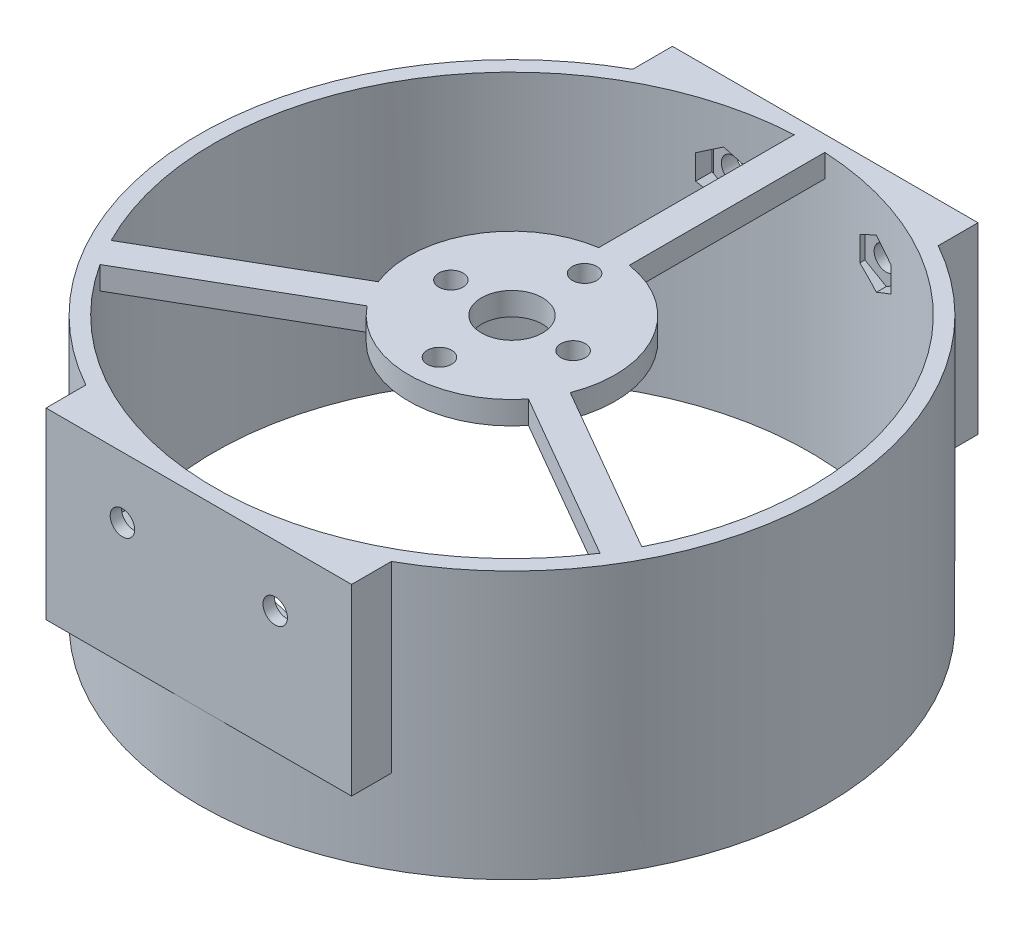
from build123d import *

# Parameters (mm, degrees)
SKETCH_1_R           = 41
SKETCH_1_R_2         = 39
EXTRUDE_1_DEPTH      = 20
EXTRUDE_START        = -14
EXTRUDE_2_DEPTH      = 14
EXTRUDE_START_2      = -3
SKETCH_3_R           = 4
SKETCH_3_R_2         = 1.6
EXTRUDE_3_DEPTH      = 3
CUT_EXTRUDE_3_DEPTH  = 3
EXTRUDE_5_DEPTH      = 10
EXTRUDE_5_DEPTH_BACK = 15
SKETCH_1_2_R         = 41
SKETCH_1_2_R_2       = 39
EXTRUDE_START_3      = 10
EXTRUDE_7_DEPTH      = 10
EXTRUDE_8_DEPTH      = 10
EXTRUDE_8_DEPTH_BACK = 5
CUT_EXTRUDE_4_DEPTH  = 80
EXTRUDE_START_4      = -24
EXTRUDE_10_DEPTH     = 24
EXTRUDE_9_DEPTH      = 10
EXTRUDE_9_DEPTH_BACK = 1.5
CUT_EXTRUDE_6_DEPTH  = 10
SKETCH_16_R          = 1.6
CUT_EXTRUDE_7_DEPTH  = 103
SKETCH_18_R          = 1.6
CUT_EXTRUDE_8_DEPTH  = 10
SKETCH_18_4_R        = 1.6
CUT_EXTRUDE_9_DEPTH  = 10


with BuildPart() as part:
    # 草图1 → 凸台-拉伸1 (new body)
    with BuildSketch(Plane(origin=(0, 0, 0), x_dir=(1, 0, 0), z_dir=(0, 1, 0))):
        Circle(SKETCH_1_R)
        Circle(SKETCH_1_R_2, mode=Mode.SUBTRACT)
    extrude(amount=EXTRUDE_1_DEPTH)

    # 草图2 → 凸台-拉伸2 (add)
    with BuildSketch(Plane(origin=(0, 20, 0), x_dir=(1, 0, 0), z_dir=(0, 1, 0)).offset(EXTRUDE_START)):
        with BuildLine():
            Line((3.5e-08, -41), (20, -41))
            Line((20, -41), (20, -35.791060336))
            ThreePointArc((20, -35.791060336), (10.333598766, -39.676400247), (3.5e-08, -41))
        make_face()
        with BuildLine():
            Line((-20, -41), (3.5e-08, -41))
            ThreePointArc((3.5e-08, -41), (-10.333598732, -39.676400256), (-20, -35.791060336))
            Line((-20, -35.791060336), (-20, -41))
        make_face()
    extrude(amount=EXTRUDE_2_DEPTH)

    # 草图3 → 凸台-拉伸3 (add)
    with BuildSketch(Plane(origin=(0, 20, 0), x_dir=(1, 0, 0), z_dir=(0, 1, 0)).offset(EXTRUDE_START_2)):
        with BuildLine():
            Line((-2, 38.948684188), (-2, 13.351029923))
            ThreePointArc((-2, 13.351029923), (-11.691342951, 6.75), (-12.56233108, -4.943464154))
            Line((-12.56233108, -4.943464154), (-34.730549951, -17.742291287))
            ThreePointArc((-34.730549951, -17.742291287), (-33.774990748, -19.5), (-32.730549951, -21.206392902))
            Line((-32.730549951, -21.206392902), (-10.56233108, -8.407565769))
            ThreePointArc((-10.56233108, -8.407565769), (0, -13.5), (10.56233108, -8.407565769))
            Line((10.56233108, -8.407565769), (32.730549951, -21.206392902))
            ThreePointArc((32.730549951, -21.206392902), (33.774990748, -19.5), (34.730549951, -17.742291287))
            Line((34.730549951, -17.742291287), (12.56233108, -4.943464154))
            ThreePointArc((12.56233108, -4.943464154), (11.691342951, 6.75), (2, 13.351029923))
            Line((2, 13.351029923), (2, 38.948684188))
            ThreePointArc((2, 38.948684188), (0, 39), (-2, 38.948684188))
        make_face()
        Circle(SKETCH_3_R, mode=Mode.SUBTRACT)
        with Locations((-8, 0)):
            Circle(SKETCH_3_R_2, mode=Mode.SUBTRACT)
        with Locations((8, 0)):
            Circle(SKETCH_3_R_2, mode=Mode.SUBTRACT)
    extrude(amount=EXTRUDE_3_DEPTH)

    # 草图7 → 切除-拉伸3 (cut)
    with BuildSketch(Plane.XZ.offset(-6)):
        with BuildLine():
            Line((0, 41), (-20, 41))
            Line((-20, 41), (-20, 35.791060336))
            ThreePointArc((-20, 35.791060336), (-10.333598749, 39.676400251), (0, 41))
        make_face()
        with BuildLine():
            Line((20, 41), (0, 41))
            ThreePointArc((0, 41), (10.333598749, 39.676400251), (20, 35.791060336))
            Line((20, 35.791060336), (20, 41))
        make_face()
    extrude(amount=-CUT_EXTRUDE_3_DEPTH, mode=Mode.SUBTRACT)

    # 草图1<2> → 凸台-拉伸5 (add, two sides: drawn at the far end of the back side and taken through both)
    with BuildSketch(Plane(origin=(0, 0, 0), x_dir=(1, 0, 0), z_dir=(0, 1, 0)).offset(-EXTRUDE_5_DEPTH_BACK)):
        Circle(SKETCH_1_2_R)
        Circle(SKETCH_1_2_R_2, mode=Mode.SUBTRACT)
    extrude(amount=EXTRUDE_5_DEPTH + EXTRUDE_5_DEPTH_BACK)

    # 草图7<4> → 凸台-拉伸7 (add)
    with BuildSketch(Plane.XZ.offset(-6).offset(EXTRUDE_START_3)):
        with BuildLine():
            Line((0, 41), (-20, 41))
            Line((-20, 41), (-20, 35.791060336))
            ThreePointArc((-20, 35.791060336), (-10.333598749, 39.676400251), (0, 41))
        make_face()
        with BuildLine():
            Line((20, 41), (0, 41))
            ThreePointArc((0, 41), (10.333598749, 39.676400251), (20, 35.791060336))
            Line((20, 35.791060336), (20, 41))
        make_face()
    extrude(amount=-EXTRUDE_7_DEPTH)

    # 草图7<5> → 凸台-拉伸8 (add, two sides: drawn at the far end of the back side and taken through both)
    with BuildSketch(Plane.XZ.offset(-6).offset(-EXTRUDE_8_DEPTH_BACK)):
        with BuildLine():
            Line((0, 41), (-20, 41))
            Line((-20, 41), (-20, 35.791060336))
            ThreePointArc((-20, 35.791060336), (-10.333598749, 39.676400251), (0, 41))
        make_face()
        with BuildLine():
            Line((20, 41), (0, 41))
            ThreePointArc((0, 41), (10.333598749, 39.676400251), (20, 35.791060336))
            Line((20, 35.791060336), (20, 41))
        make_face()
    extrude(amount=EXTRUDE_8_DEPTH + EXTRUDE_8_DEPTH_BACK)

    # 草图4 → 切除-拉伸4 (cut)
    with BuildSketch(Plane.XY.offset(41)):
        Polygon((-10, 8.766838493), (-7.2, 10.383419246), (-7.2, 13.616580754), (-10, 15.233161507), (-12.8, 13.616580754), (-12.8, 10.383419246), align=None)
        Polygon((12.8, 10.383419246), (10, 8.766838493), (7.2, 10.383419246), (7.2, 13.616580754), (10, 15.233161507), (12.8, 13.616580754), align=None)
    extrude(amount=-CUT_EXTRUDE_4_DEPTH, mode=Mode.SUBTRACT)

    # 草图20 → 凸台-拉伸10 (add)
    with BuildSketch(Plane(origin=(0, 20, 0), x_dir=(1, 0, 0), z_dir=(0, 1, 0)).offset(EXTRUDE_START_4)):
        with BuildLine():
            Line((20, 41), (1.85e-07, 41))
            ThreePointArc((1.85e-07, 41), (10.333598839, 39.676400228), (20, 35.791060336))
            Line((20, 35.791060336), (20, 41))
        make_face()
        with BuildLine():
            Line((-20, 41), (-20, 35.791060336))
            ThreePointArc((-20, 35.791060336), (-10.333598659, 39.676400275), (1.85e-07, 41))
            Line((1.85e-07, 41), (-20, 41))
        make_face()
    extrude(amount=EXTRUDE_10_DEPTH)

    # 草图4<3> → 凸台-拉伸9 (add, two sides: drawn at the far end of the back side and taken through both)
    with BuildSketch(Plane.XY.offset(41).offset(-EXTRUDE_9_DEPTH_BACK)):
        Polygon((-10, 8.766838493), (-7.2, 10.383419246), (-7.2, 13.616580754), (-10, 15.233161507), (-12.8, 13.616580754), (-12.8, 10.383419246), align=None)
        Polygon((12.8, 10.383419246), (10, 8.766838493), (7.2, 10.383419246), (7.2, 13.616580754), (10, 15.233161507), (12.8, 13.616580754), align=None)
    extrude(amount=EXTRUDE_9_DEPTH + EXTRUDE_9_DEPTH_BACK)

    # 草图13 → 切除-拉伸6 (cut)
    with BuildSketch(Plane.XY.offset(51)):
        Polygon((10, 15.233161507), (7.2, 13.616580754), (7.2, 10.383419246), (10, 8.766838493), (12.8, 10.383419246), (12.8, 13.616580754), align=None)
        Polygon((-10, 15.233161507), (-12.8, 13.616580754), (-12.8, 10.383419246), (-10, 8.766838493), (-7.2, 10.383419246), (-7.2, 13.616580754), align=None)
    extrude(amount=-CUT_EXTRUDE_6_DEPTH, mode=Mode.SUBTRACT)

    # 草图16 → 切除-拉伸7 (cut)
    with BuildSketch(Plane.XY.offset(41)):
        with Locations((-10, 12)):
            Circle(SKETCH_16_R)
        with Locations((10, 12)):
            Circle(SKETCH_16_R)
    extrude(amount=-CUT_EXTRUDE_7_DEPTH, mode=Mode.SUBTRACT)

    # 草图18 → 切除-拉伸8 (cut)
    with BuildSketch(Plane(origin=(0, 20, 0), x_dir=(1, 0, 0), z_dir=(0, 1, 0))):
        with Locations((0, 9.5)):
            Circle(SKETCH_18_R)
    extrude(amount=-CUT_EXTRUDE_8_DEPTH, mode=Mode.SUBTRACT)

    # 草图18<4> → 切除-拉伸9 (cut)
    with BuildSketch(Plane(origin=(0, 20, 0), x_dir=(1, 0, 0), z_dir=(0, 1, 0))):
        with Locations((0, 9.5)):
            Circle(SKETCH_18_4_R)
        with Locations((0, -9.5)):
            Circle(SKETCH_18_4_R)
    extrude(amount=-CUT_EXTRUDE_9_DEPTH, mode=Mode.SUBTRACT)


solid = part.part
